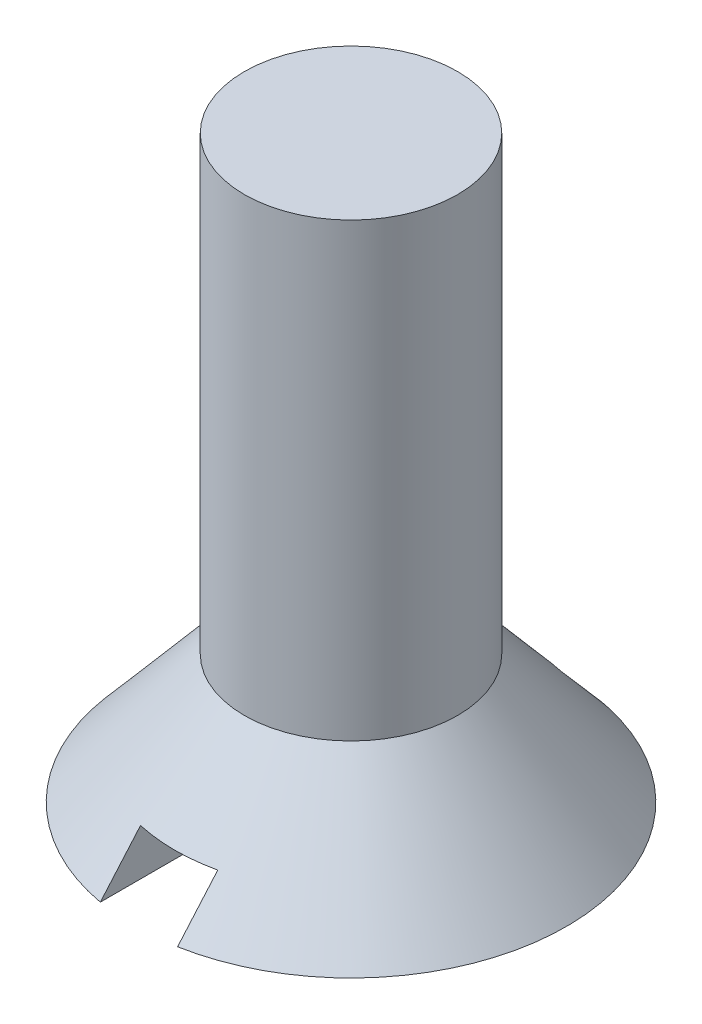
from build123d import *

# Parameters (mm, degrees)
SKETCH3_R               = 1.7526
BOSS_EXTRUDE1_DEPTH     = 7.4168
CUT_EXTRUDE1_DEPTH      = 4.1148
CUT_EXTRUDE1_DEPTH_BACK = 4.572


with BuildPart() as part:
    # Sketch2 → Revolve2 (revolve)
    with BuildSketch(Plane.XY):
        Polygon((3.5433, 0), (0, 0), (0, 2.1082), (1.7526, 2.1082), align=None)
    revolve(axis=Axis((0, 2.1082, 0), (0, -1, 0)))

    # Sketch3 → Boss-Extrude1 (add)
    with BuildSketch(Plane(origin=(0, 2.1082, 0), x_dir=(-1, 0, 0), z_dir=(0, 1, 0))):
        Circle(SKETCH3_R)
    extrude(amount=BOSS_EXTRUDE1_DEPTH)

    # Sketch4 → Cut-Extrude1 (cut, two sides: drawn at the far end of the back side and taken through both)
    with BuildSketch(Plane.XY.offset(-CUT_EXTRUDE1_DEPTH_BACK)):
        Polygon((0, 0), (0.635, 0), (0.635, 0.762), (0.123756422, 0.762), (-0.635, 0.762), (-0.635, 0), align=None)
    extrude(amount=CUT_EXTRUDE1_DEPTH + CUT_EXTRUDE1_DEPTH_BACK, mode=Mode.SUBTRACT)


solid = part.part
